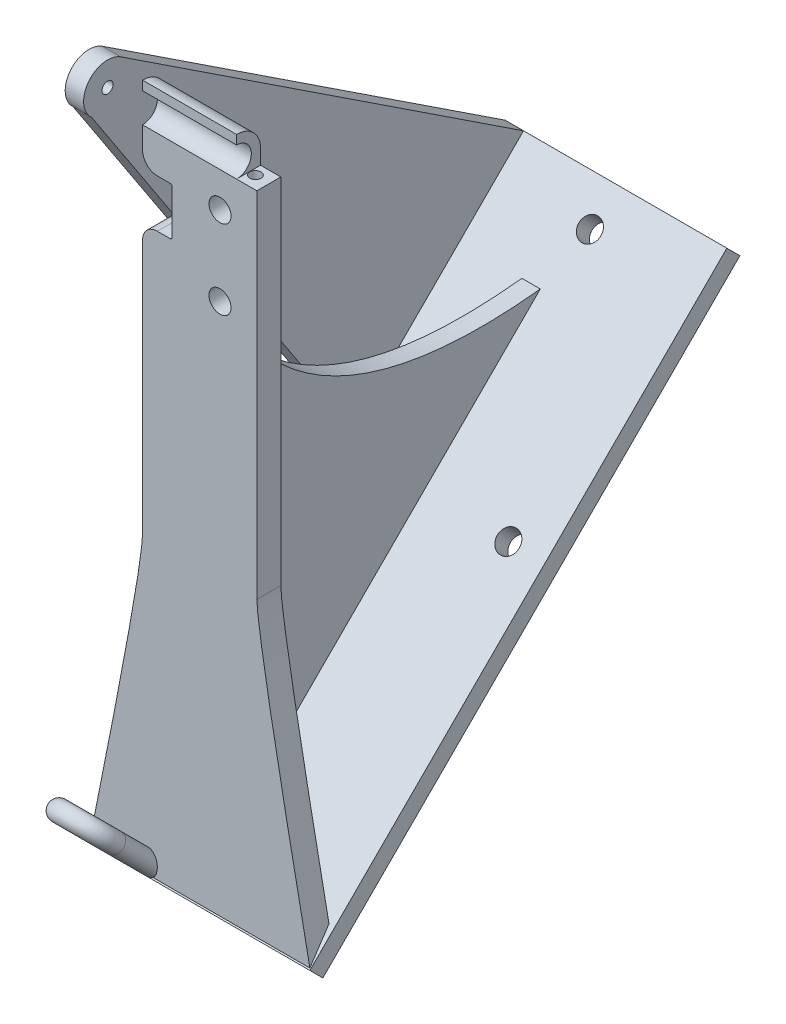
from build123d import *

# Parameters (mm, degrees)
BOSS_EXTRUDE1_DEPTH = 6.5
SKETCH2_W           = 60.158889846
SKETCH2_H           = 160
BOSS_EXTRUDE3_DEPTH = 5
SKETCH6_R           = 3
CUT_EXTRUDE7_DEPTH  = 5.1
BOSS_EXTRUDE4_DEPTH = 31
CUT_EXTRUDE8_REACH  = 196.785
SKETCH11_W          = 5.5
SKETCH11_H          = 10.5
CUT_EXTRUDE9_REACH  = 194.771
SKETCH13_R          = 1.5
CUT_EXTRUDE10_DEPTH = 17
CUT_EXTRUDE11_REACH = 196.785
SKETCH14_R          = 3
BOSS_EXTRUDE5_START = -5
SKETCH15_R          = 1.5
BOSS_EXTRUDE5_DEPTH = 5
RIB2_START          = -2.5
RIB2_DEPTH          = 5
CUT_EXTRUDE12_REACH = 196.785
SKETCH17_W          = 8
SKETCH17_H          = 13
FILLET1_R           = 4
FILLET2_R           = 0.5
SWEEP1_PROFILE_R    = 2.5


# Read off the part's stored shape, not the designer's step: Rib2
with BuildPart() as part:
    # Sketch1 → Boss-Extrude1 (new body)
    with BuildSketch(Plane.XY):
        with BuildLine():
            Line((-15.5, -70), (-15.5, 30))
            Line((-15.5, 30), (15.5, 30))
            Line((15.5, 30), (15.5, -70))
            add(Edge.make_bspline(
                [(15.5, -70), (15.682751911, -79.304401058), (30, -150)],
                knots=[0.243669215, 0.243669215, 0.243669215, 1, 1, 1], degree=2))
            Line((30, -150), (-30, -150))
            add(Edge.make_bspline(
                [(-15.5, -70), (-15.682751911, -79.304401058), (-30, -150)],
                knots=[0.243669215, 0.243669215, 0.243669215, 1, 1, 1], degree=2))
        make_face()
    extrude(amount=BOSS_EXTRUDE1_DEPTH)

    # Sketch2 → Boss-Extrude3 (add)
    with BuildSketch(Plane(origin=(0, -75, -75), x_dir=(1, 0, 0), z_dir=(0, 0.7071067811865488, 0.7071067811865464))):
        with Locations((0.079444923, -30.662211256)):
            Rectangle(SKETCH2_W, SKETCH2_H)
    extrude(amount=BOSS_EXTRUDE3_DEPTH)

    # Sketch6 → Cut-Extrude7 (cut)
    with BuildSketch(Plane(origin=(0, -75, -75), x_dir=(-1, 0, 0), z_dir=(0, -0.7071067811865487, -0.7071067811865464))):
        with Locations(Location((-20.158889846, -20.363007156, 0), (0, 0, 90))):
            Circle(SKETCH6_R)
        with Locations(Location((20, -20.363007156, 0), (0, 0, 90))):
            Circle(SKETCH6_R)
        with Locations(Location((-0.079444923, 39.337788744, 0), (0, 0, 90))):
            Circle(SKETCH6_R)
    extrude(amount=-CUT_EXTRUDE7_DEPTH, mode=Mode.SUBTRACT)

    # Sketch10 → Boss-Extrude4 (add)
    with BuildSketch(Plane(origin=(15.5, 0, 0), x_dir=(0, 0, -1), z_dir=(1, 0, 0))):
        with BuildLine():
            Line((-6.5, 36.5), (-6.5, 30))
            Line((-6.5, 30), (0, 30))
            ThreePointArc((0, 30), (-1.903805922, 34.596194078), (-6.5, 36.5))
        make_face()
    extrude(amount=-BOSS_EXTRUDE4_DEPTH)

    # Sketch11 → Cut-Extrude8 (cut, up to next)
    with BuildSketch(Plane.XY.offset(6.5), mode=Mode.PRIVATE) as cut_extrude8_sk1:
        with Locations((12.75, 31.25)):
            Rectangle(SKETCH11_W, SKETCH11_H)
    cut_extrude8_tool1 = extrude(cut_extrude8_sk1.sketch, amount=-CUT_EXTRUDE8_REACH, mode=Mode.PRIVATE) & part.part
    add(cut_extrude8_tool1.solids().sort_by_distance((12.75, 31.25, 6.5))[0], mode=Mode.SUBTRACT)

    # Sketch12 → Cut-Extrude9 (cut, up to next)
    with BuildSketch(Plane(origin=(10, 0, 0), x_dir=(0, 0, -1), z_dir=(1, 0, 0)), mode=Mode.PRIVATE) as cut_extrude9_sk1:
        with BuildLine():
            Line((-6.5, 34), (-6.5, 26))
            ThreePointArc((-6.5, 26), (-2.5, 30), (-6.5, 34))
        make_face()
    cut_extrude9_tool1 = extrude(cut_extrude9_sk1.sketch, amount=-CUT_EXTRUDE9_REACH, mode=Mode.PRIVATE) & part.part
    add(cut_extrude9_tool1.solids().sort_by_distance((10, 30, 4.802347))[0], mode=Mode.SUBTRACT)

    # Sketch13 → Cut-Extrude10 (cut)
    with BuildSketch(Plane(origin=(-3.389594105, 24.118215268, 0), x_dir=(0, 0, 1), z_dir=(-0.13917310096006605, 0.9902680687415703, 0))):
        with Locations(Location((3, 15.121181312, 0), (0, 0, 270))):
            Circle(SKETCH13_R)
    extrude(amount=-CUT_EXTRUDE10_DEPTH, mode=Mode.SUBTRACT)

    # Sketch14 → Cut-Extrude11 (cut, up to next)
    with BuildSketch(Plane.XY.offset(6.5), mode=Mode.PRIVATE) as cut_extrude11_sk1:
        with Locations((5.5, 16.5)):
            Circle(SKETCH14_R)
    cut_extrude11_tool1 = extrude(cut_extrude11_sk1.sketch, amount=-CUT_EXTRUDE11_REACH, mode=Mode.PRIVATE) & part.part
    # Sketch14 → Cut-Extrude11 (cut, up to next)
    with BuildSketch(Plane.XY.offset(6.5), mode=Mode.PRIVATE) as cut_extrude11_sk2:
        with Locations((5.5, -5)):
            Circle(SKETCH14_R)
    cut_extrude11_tool2 = extrude(cut_extrude11_sk2.sketch, amount=-CUT_EXTRUDE11_REACH, mode=Mode.PRIVATE) & part.part
    add(cut_extrude11_tool1.solids().sort_by_distance((5.5, 16.5, 6.5))[0], mode=Mode.SUBTRACT)
    add(cut_extrude11_tool2.solids().sort_by_distance((5.5, -5, 6.5))[0], mode=Mode.SUBTRACT)

    # Sketch15 → Boss-Extrude5 (add)
    with BuildSketch(Plane.ZY.offset(30).offset(BOSS_EXTRUDE5_START)):
        with BuildLine():
            Line((2.923559779, 35.427621518), (-106.351551084, -36.577381104))
            Line((-106.351551084, -36.577381104), (-60.077932214, -82.850999974))
            Line((-60.077932214, -82.850999974), (10.840158065, 25.161298937))
            ThreePointArc((10.840158065, 25.161298937), (11.647345051, 33.969236568), (2.923559779, 35.427621518))
        make_face()
        with Locations(Location((6.5, 30, 0), (0, 0, 270))):
            Circle(SKETCH15_R, mode=Mode.SUBTRACT)
    extrude(amount=BOSS_EXTRUDE5_DEPTH)

    # Rib2 outline → Rib2 (add)
    with BuildSketch(Plane(origin=(-5.5, 0, 0), x_dir=(0, 0, -1), z_dir=(1, 0, 0)).offset(RIB2_START)):
        with BuildLine():
            Line((0, -142.928932188), (88.904911914, -54.024020274))
            add(Edge.make_bspline(
                [(88.904911914, -54.024020274), (20.400745035, -61.458454661), (0, -7.927359395)],
                knots=[0, 0, 0, 1, 1, 1], degree=2))
            Line((0, -7.927359395), (0, -142.928932188))
        make_face()
    extrude(amount=RIB2_DEPTH)

    # Sketch17 → Cut-Extrude12 (cut, up to next)
    with BuildSketch(Plane.XY.offset(6.5), mode=Mode.PRIVATE) as cut_extrude12_sk1:
        with Locations((-11.5, 9.5)):
            Rectangle(SKETCH17_W, SKETCH17_H)
    cut_extrude12_tool1 = extrude(cut_extrude12_sk1.sketch, amount=-CUT_EXTRUDE12_REACH, mode=Mode.PRIVATE) & part.part
    add(cut_extrude12_tool1.solids().sort_by_distance((-11.5, 9.5, 6.5))[0], mode=Mode.SUBTRACT)

    # Fillet1
    fillet1_edges = [part.edges().sort_by_distance(p)[0] for p in [
        (-15.5, 3, 3.25),
        (-15.5, 16, 3.25),
    ]]
    fillet(fillet1_edges, radius=FILLET1_R)

    # Fillet2
    fillet2_edges = [part.edges().sort_by_distance(p)[0] for p in [
        (-7.5, 16, 3.25),
        (-7.5, 3, 3.25),
    ]]
    fillet(fillet2_edges, radius=FILLET2_R)

    # Sweep1: sweep along a path in Sketch18
    with BuildLine(Plane(origin=(0, -76.482233047, 76.482233047), x_dir=(-1, 0, 0), z_dir=(0, -0.7071067811865464, 0.7071067811865488))) as sweep1_path:
        Line((27.5, 101.066017178), (27.5, 86.066017178))
        ThreePointArc((27.5, 86.066017178), (20.75, 79.316017178), (14, 86.066017178))
        Line((14, 86.066017178), (14, 101.066017178))
    # Sweep1 profile (on start of the path) → Sweep1 (sweep)
    with BuildSketch(Plane(origin=(-27.5, -147.946699141, 5.017766953), x_dir=(0, -0.7071067811865464, 0.7071067811865488), z_dir=(0, 0.7071067811865488, 0.7071067811865464))):
        Circle(SWEEP1_PROFILE_R)
    sweep(path=sweep1_path.line)


solid = part.part
